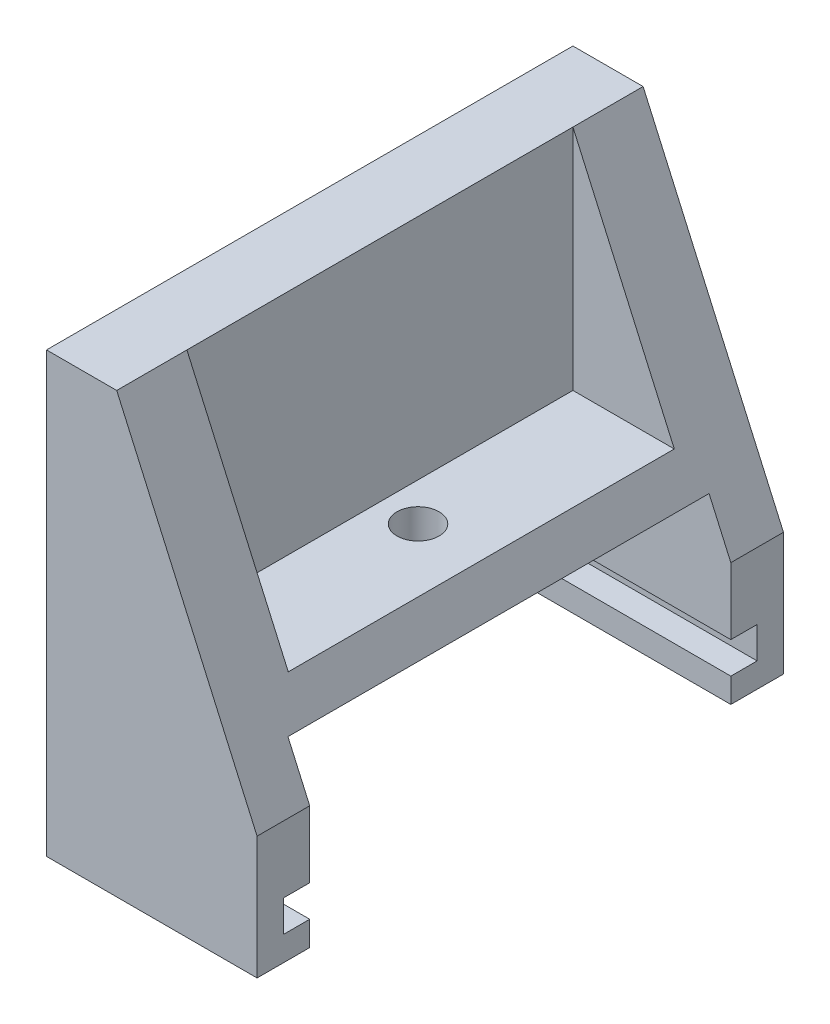
from build123d import *

# Parameters (mm, degrees)
BOSS_EXTRUDE1_DEPTH = 30
SKETCH4_W           = 24
SKETCH4_H           = 10
CUT_EXTRUDE2_DEPTH  = 25
SKETCH5_W           = 1.5
SKETCH5_H           = 1.8
CUT_EXTRUDE3_DEPTH  = 15
CUT_EXTRUDE4_DEPTH  = 11
SKETCH7_R           = 1.2
CUT_EXTRUDE5_DEPTH  = 4


with BuildPart() as part:
    # Sketch1 → Boss-Extrude1 (new body)
    with BuildSketch(Plane.XY):
        Polygon((0, 0), (0, -25), (12, -25), (12, -18), (4, 0), align=None)
    extrude(amount=-BOSS_EXTRUDE1_DEPTH)

    # Sketch4 → Cut-Extrude2 (cut)
    with BuildSketch(Plane.ZY):
        with Locations((-15, -20.207997185)):
            Rectangle(SKETCH4_W, SKETCH4_H)
    extrude(amount=-CUT_EXTRUDE2_DEPTH, mode=Mode.SUBTRACT)

    # Sketch5 → Cut-Extrude3 (cut)
    with BuildSketch(Plane.ZY):
        with Locations((-2.25, -22.7)):
            Rectangle(SKETCH5_W, SKETCH5_H)
    cut_extrude3 = extrude(amount=-CUT_EXTRUDE3_DEPTH, mode=Mode.SUBTRACT)

    # Mirror1: Cut-Extrude3 across plane
    add(cut_extrude3.mirror(Plane.XY.offset(-15)), mode=Mode.SUBTRACT)

    # Sketch6 → Cut-Extrude4 (cut, symmetric)
    with BuildSketch(Plane.XY.offset(-15)):
        Polygon((4, 0), (4, -13), (9.777777778, -13), align=None)
    extrude(amount=CUT_EXTRUDE4_DEPTH, both=True, mode=Mode.SUBTRACT)

    # Sketch7 → Cut-Extrude5 (cut)
    with BuildSketch(Plane(origin=(0, -13, 0), x_dir=(1, 0, 0), z_dir=(0, 1, 0))):
        with Locations((6.172753197, 15)):
            Circle(SKETCH7_R)
    extrude(amount=-CUT_EXTRUDE5_DEPTH, mode=Mode.SUBTRACT)


solid = part.part
